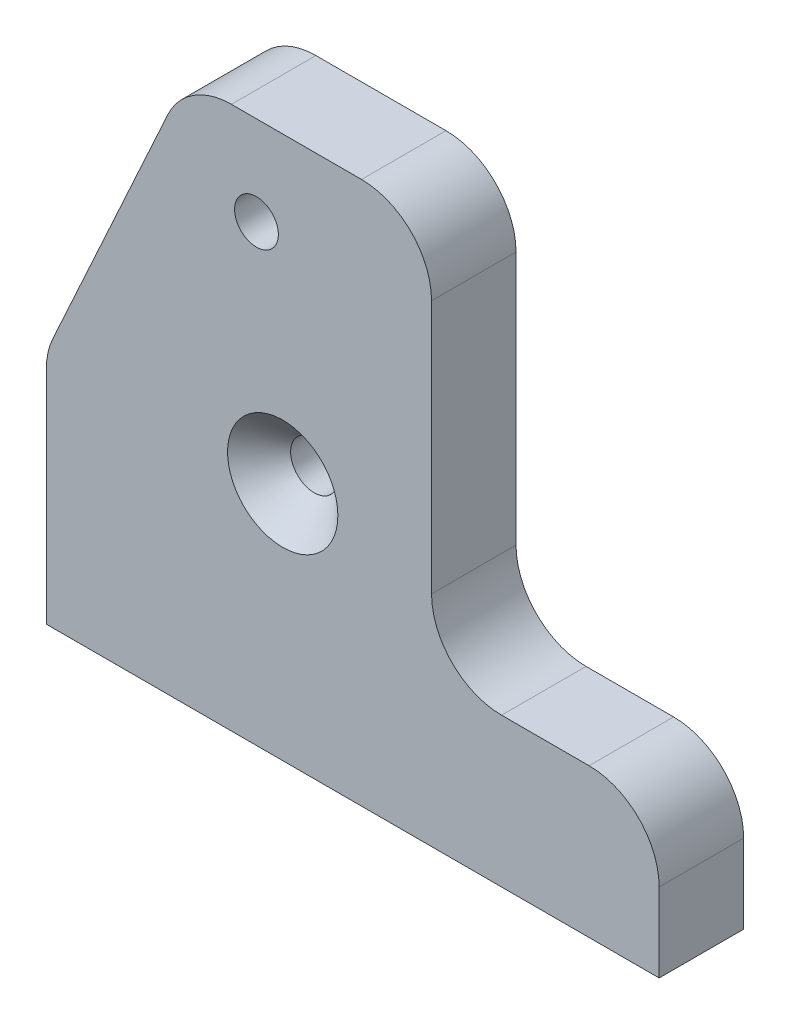
from build123d import *

# Parameters (mm, degrees)
BOSS_EXTRUDE1_DEPTH                             = 4.826
M3X0_5_TAPPED_HOLE2_D                           = 2.5
M3X0_5_TAPPED_HOLE3_D                           = 2.5
M3X0_5_TAPPED_HOLE3_DEPTH                       = 5
M3X0_5_TAPPED_HOLE3_TIP                         = 0.751075774
FILLET2_R                                       = 4
CUT_EXTRUDE1_DEPTH                              = 10
CSK_FOR_M3_FLAT_HEAD_MACHINE_SCREW1_D           = 2.7
CSK_FOR_M3_FLAT_HEAD_MACHINE_SCREW1_CSINK_D     = 6.3
CSK_FOR_M3_FLAT_HEAD_MACHINE_SCREW1_CSINK_ANGLE = 90


with BuildPart() as part:
    # Sketch1 → Boss-Extrude1 (new body)
    with BuildSketch(Plane.XY):
        Polygon((0, 13.5), (0, 0), (35, 0), (35, 8.5), (22, 8.5), (22, 31), (8, 31), align=None)
    extrude(amount=BOSS_EXTRUDE1_DEPTH)

    # M3x0.5 Tapped Hole2 (through all)
    with Locations(Plane.XY.offset(4.826)):
        with Locations((12, 25.9)):
            Hole(M3X0_5_TAPPED_HOLE2_D / 2)

    # M3x0.5 Tapped Hole3
    with Locations(Plane(origin=(0, 0, 0), x_dir=(-1, 0, 0), z_dir=(0, -1, 0))):
        with Locations((-16.73, -2.413), (-28.73, -2.413)):
            Hole(M3X0_5_TAPPED_HOLE3_D / 2, depth=M3X0_5_TAPPED_HOLE3_DEPTH)
            with Locations((0, 0, -(M3X0_5_TAPPED_HOLE3_DEPTH + M3X0_5_TAPPED_HOLE3_TIP / 2))):  # 118° drill point
                Cone(0, M3X0_5_TAPPED_HOLE3_D / 2, M3X0_5_TAPPED_HOLE3_TIP, mode=Mode.SUBTRACT)

    # Fillet2
    fillet2_edges = [part.edges().sort_by_distance(p)[0] for p in [
        (35, 8.5, 2.413),
        (22, 8.5, 2.413),
        (22, 31, 2.413),
        (0, 13.5, 2.413),
        (8, 31, 2.413),
    ]]
    fillet(fillet2_edges, radius=FILLET2_R)

    # Sketch19 → Cut-Extrude1 (cut)
    with BuildSketch(Plane.XY.offset(4.826)):
        with BuildLine():
            ThreePointArc((12.25, 13.7), (13.5, 12.45), (14.75, 13.7))
            ThreePointArc((14.75, 13.7), (13.5, 14.95), (12.25, 13.7))
        make_face()
    extrude(amount=-CUT_EXTRUDE1_DEPTH, mode=Mode.SUBTRACT)

    # CSK for M3 Flat Head Machine Screw1 (through all)
    with Locations(Plane.XY.offset(4.826)):
        with Locations((13.5, 13.7)):
            CounterSinkHole(CSK_FOR_M3_FLAT_HEAD_MACHINE_SCREW1_D / 2, CSK_FOR_M3_FLAT_HEAD_MACHINE_SCREW1_CSINK_D / 2, counter_sink_angle=CSK_FOR_M3_FLAT_HEAD_MACHINE_SCREW1_CSINK_ANGLE)


solid = part.part
